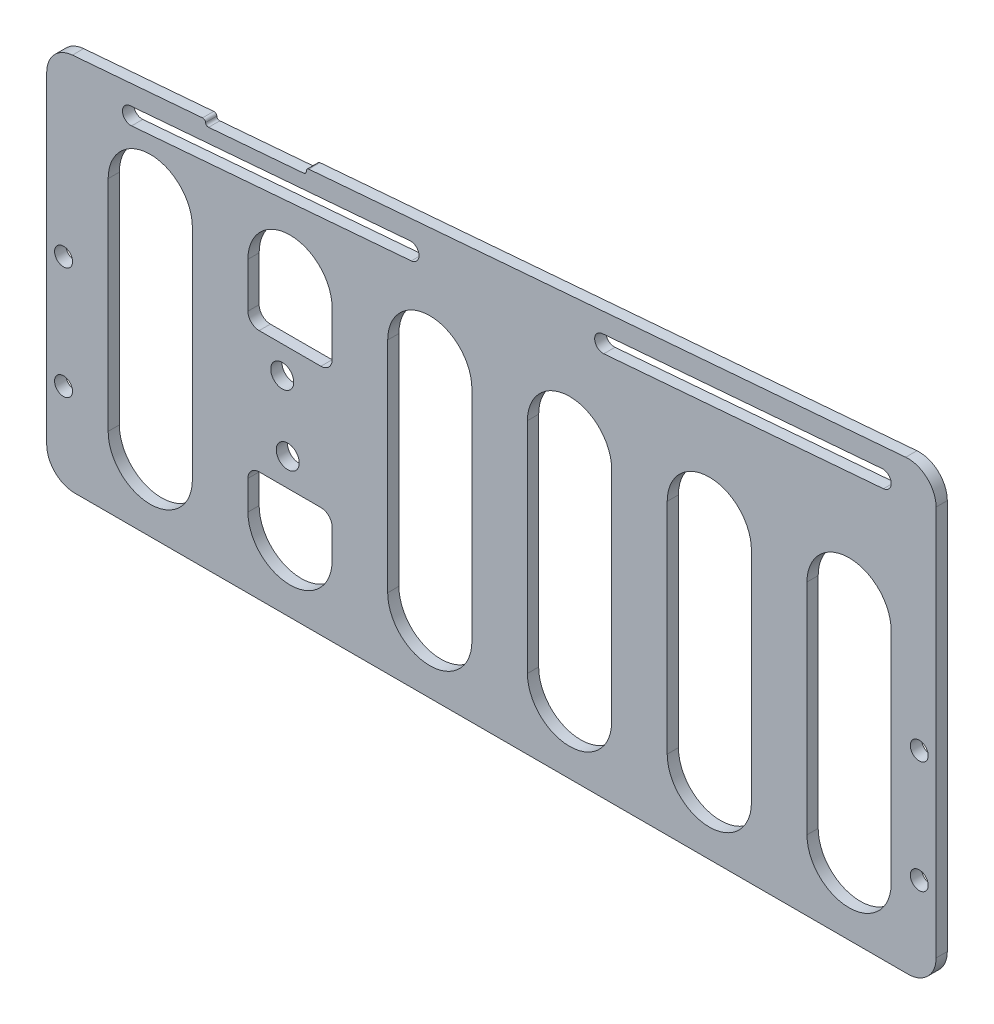
from build123d import *

# Parameters (mm, degrees)
SKETCH_1_W             = 158.45
SKETCH_1_H             = 60
EXTRUDE_1_DEPTH        = 2
SKETCH_2_R             = 1.6
CUT_EXTRUDE_1_DEPTH    = 10
EXTRUDE_2_DEPTH        = 2
CUT_EXTRUDE_2_DEPTH    = 10
PATTERN_LINEAR_1_COUNT = 6
PATTERN_LINEAR_1_PITCH = 24.9
FILLET_1_R             = 5
CUT_EXTRUDE_3_DEPTH    = 10
SKETCH_6_W             = 15
SKETCH_6_H             = 21.8
EXTRUDE_3_DEPTH        = 2
SKETCH_7_R             = 2.05
CUT_EXTRUDE_4_DEPTH    = 10
FILLET_2_R             = 2
SKETCH_8_W             = 18
SKETCH_8_H             = 2
CUT_EXTRUDE_5_DEPTH    = 1
FILLET_3_R             = 0.5


with BuildPart() as part:
    # 草图1 → 凸台-拉伸1 (new body)
    with BuildSketch(Plane.XY):
        Rectangle(SKETCH_1_W, SKETCH_1_H)
    extrude(amount=EXTRUDE_1_DEPTH)

    # 草图2 → 切除-拉伸1 (cut)
    with BuildSketch(Plane.XY.offset(2)):
        with Locations((-76.225, -14.5)):
            Circle(SKETCH_2_R)
        with Locations((-76.225, 5.5)):
            Circle(SKETCH_2_R)
        with Locations((76.225, -14.5)):
            Circle(SKETCH_2_R)
        with Locations((76.225, 5.5)):
            Circle(SKETCH_2_R)
    extrude(amount=-CUT_EXTRUDE_1_DEPTH, mode=Mode.SUBTRACT)

    # 草图3 → 凸台-拉伸2 (add)
    with BuildSketch(Plane(origin=(0, 0, 0), x_dir=(-1, 0, 0), z_dir=(0, 0, -1))):
        Polygon((-79.225, 30), (-79.225, 50), (79.225, 37), (79.225, 30), align=None)
    extrude(amount=-EXTRUDE_2_DEPTH)

    # 草图4 → 切除-拉伸2 (cut)
    with BuildSketch(Plane(origin=(0, 0, 0), x_dir=(-1, 0, 0), z_dir=(0, 0, -1))):
        with BuildLine():
            Line((-56.225, 21.5), (-56.225, -17.5))
            ThreePointArc((-56.225, -17.5), (-63.725, -25), (-71.225, -17.5))
            Line((-71.225, -17.5), (-71.225, 21.5))
            ThreePointArc((-71.225, 21.5), (-63.725, 29), (-56.225, 21.5))
        make_face()
    cut_extrude_2 = extrude(amount=-CUT_EXTRUDE_2_DEPTH, mode=Mode.SUBTRACT)

    # 阵列(线性)1: 切除-拉伸2 ×6
    with Locations(*[(-i * PATTERN_LINEAR_1_PITCH, 0, 0) for i in range(1, PATTERN_LINEAR_1_COUNT)]):
        add(cut_extrude_2, mode=Mode.SUBTRACT)

    # 圆角1
    fillet_1_edges = [part.edges().sort_by_distance(p)[0] for p in [
        (79.225, 50, 1),
        (-79.225, 37, 1),
        (79.225, -30, 1),
        (-79.225, -30, 1),
    ]]
    fillet(fillet_1_edges, radius=FILLET_1_R)

    # 草图5 → 切除-拉伸3 (cut)
    with BuildSketch(Plane(origin=(0, 0, 0), x_dir=(-1, 0, 0), z_dir=(0, 0, -1))):
        with BuildLine():
            Line((-69.607368079, 45.699163119), (-19.774807001, 41.610660159))
            ThreePointArc((-19.774807001, 41.610660159), (-18.402485258, 39.993028237), (-20.020117179, 38.620706494))
            Line((-20.020117179, 38.620706494), (-69.852678256, 42.709209454))
            ThreePointArc((-69.852678256, 42.709209454), (-71.225, 44.326841375), (-69.607368079, 45.699163119))
        make_face()
        with BuildLine():
            Line((14.515094011, 38.797351776), (64.347655089, 34.708848816))
            ThreePointArc((64.347655089, 34.708848816), (65.719976832, 33.091216895), (64.102344911, 31.718895152))
            Line((64.102344911, 31.718895152), (14.269783834, 35.807398112))
            ThreePointArc((14.269783834, 35.807398112), (12.89746209, 37.425030033), (14.515094011, 38.797351776))
        make_face()
    extrude(amount=-CUT_EXTRUDE_3_DEPTH, mode=Mode.SUBTRACT)

    # 草图6 → 凸台-拉伸3 (add)
    with BuildSketch(Plane.XY.offset(2)):
        with Locations((-35.875, 0.6)):
            Rectangle(SKETCH_6_W, SKETCH_6_H)
    extrude(amount=-EXTRUDE_3_DEPTH)

    # 草图7 → 切除-拉伸4 (cut)
    with BuildSketch(Plane.XY.offset(2)):
        with Locations((-37.261557274, 6.6)):
            Circle(SKETCH_7_R)
        with Locations((-36.280316563, -5.359814659)):
            Circle(SKETCH_7_R)
    extrude(amount=-CUT_EXTRUDE_4_DEPTH, mode=Mode.SUBTRACT)

    # 圆角2
    fillet_2_edges = [part.edges().sort_by_distance(p)[0] for p in [
        (-28.375, -10.3, 1),
        (-28.375, 11.5, 1),
        (-43.375, 11.5, 1),
        (-43.375, -10.3, 1),
    ]]
    fillet(fillet_2_edges, radius=FILLET_2_R)

    # 草图8 → 切除-拉伸5 (cut)
    with BuildSketch(Plane(origin=(-3.545085978, 43.209144098, 0), x_dir=(0.9966512215507048, 0.08177005919948983, 0), z_dir=(-0.08177005919948983, 0.9966512215507048, 0))):
        with Locations((-38.57643531, -1)):
            Rectangle(SKETCH_8_W, SKETCH_8_H)
    extrude(amount=-CUT_EXTRUDE_5_DEPTH, mode=Mode.SUBTRACT)

    # 圆角3
    fillet_3_edges = [part.edges().sort_by_distance(p)[0] for p in [
        (-50.880428288, 38.322164944, 1),
        (-32.9407063, 39.79402601, 1),
    ]]
    fillet(fillet_3_edges, radius=FILLET_3_R)
    fillet_3_2_edges = [part.edges().sort_by_distance(p)[0] for p in [
        (-50.962198347, 39.318816166, 1),
        (-33.022476359, 40.790677231, 1),
    ]]
    fillet(fillet_3_2_edges, radius=FILLET_3_R - 0.0001)  # a hair under: the kernel refuses the full size


solid = part.part
